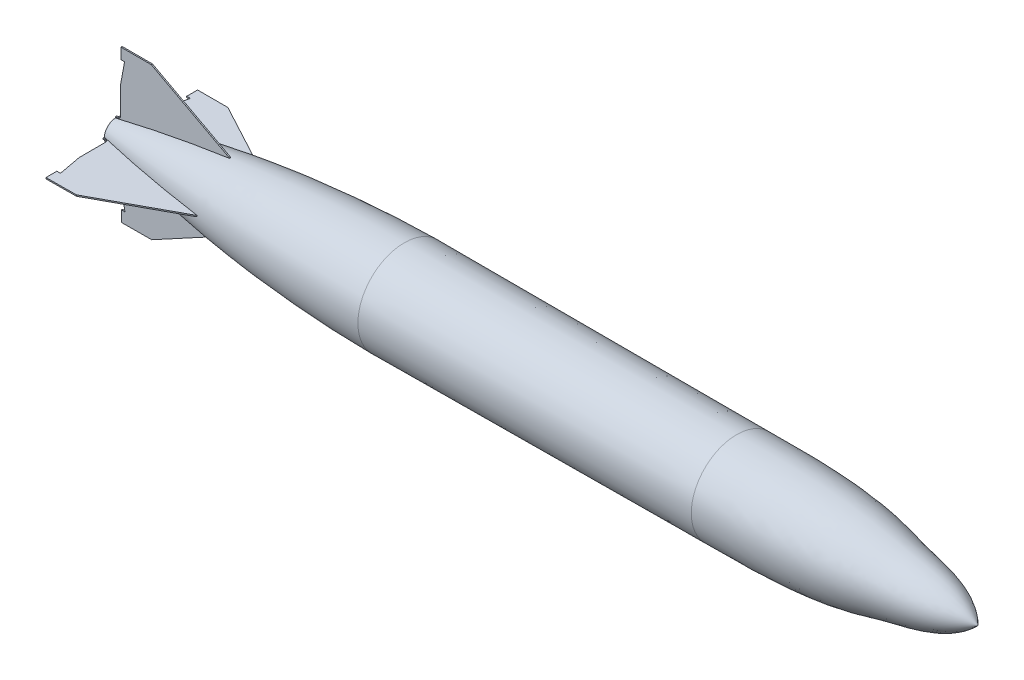
from build123d import *

# Parameters (mm, degrees)
BOSS_EXTRUDE7_START       = 16270.18893537
BOSS_EXTRUDE7_OUTLINE_W   = 44.458339497
BOSS_EXTRUDE7_OUTLINE_H   = 10
BOSS_EXTRUDE7_DEPTH       = 37.555983991
BOSS_EXTRUDE7_START_2     = 16307.744919361
BOSS_EXTRUDE7_2_OUTLINE_W = 4.71364866
BOSS_EXTRUDE7_2_OUTLINE_H = 10
BOSS_EXTRUDE7_2_DEPTH     = 234.687353232
BOSS_EXTRUDE7_START_3     = -5
BOSS_EXTRUDE7_3_DEPTH     = 10
CIRPATTERN13_COUNT        = 4


with BuildPart() as part:
    # Sketch1 → Revolve1 (revolve)
    with BuildSketch(Plane.XY):
        with BuildLine():
            Line((-8927.058200196, 16586.361109833), (-11607.886324288, 16586.361109833))
            add(Edge.make_bspline(
                [(-11607.886324288, 16586.361109833), (-12794.00079163, 16572.101167552), (-13932.987155433, 16298.272117393)],
                knots=[0, 0, 0, 1, 1, 1], degree=2))
            Line((-13932.987155433, 16298.272117393), (-13932.987155433, 16203.629642747))
            Line((-13932.987155433, 16203.629642747), (-6979.778583019, 16226.142638256))
            add(Edge.make_bspline(
                [(-6979.778583019, 16226.142638256), (-7150.744503464, 16405.274346255), (-7653.482511182, 16454.856105961), (-8044.85823717, 16598.87957134), (-8927.058200196, 16586.361109833)],
                knots=[0, 0, 0, 0, 0.479283423, 1, 1, 1, 1], degree=3))
        make_face()
    revolve(axis=Axis((-6979.778583019, 16226.142638256, 0), (-0.9999947584148503, -0.0032377681858395966, 0)))

    # Boss-Extrude7: read off the stored shape, not the designer's step
    # Boss-Extrude7 outline → Boss-Extrude7 (add)
    with BuildSketch(Plane(origin=(0, 0, 0), x_dir=(1, 0, 0), z_dir=(0, 1, 0)).offset(BOSS_EXTRUDE7_START)):
        with Locations((-13910.757985685, 0)):
            Rectangle(BOSS_EXTRUDE7_OUTLINE_W, BOSS_EXTRUDE7_OUTLINE_H)
    boss_extrude7 = extrude(amount=BOSS_EXTRUDE7_DEPTH)

    # Boss-Extrude7 2 outline → Boss-Extrude7 2 (add)
    with BuildSketch(Plane(origin=(0, 0, 0), x_dir=(1, 0, 0), z_dir=(0, 1, 0)).offset(BOSS_EXTRUDE7_START_2)):
        with Locations((-13890.885640266, 0)):
            Rectangle(BOSS_EXTRUDE7_2_OUTLINE_W, BOSS_EXTRUDE7_2_OUTLINE_H)
    boss_extrude7_2 = extrude(amount=BOSS_EXTRUDE7_2_DEPTH)

    # Boss-Extrude7 3 outline → Boss-Extrude7 3 (add)
    with BuildSketch(Plane.XY.offset(BOSS_EXTRUDE7_START_3)):
        with BuildLine():
            ThreePointArc((-13013.286562324, 16475.90038698), (-13016.415282103, 16479.426088343), (-13020.282277859, 16482.121603392))
            Line((-13020.282277859, 16482.121603392), (-13643.830616351, 16815.219302052))
            Line((-13643.830616351, 16815.219302052), (-13888.528815936, 16815.219302052))
            Line((-13888.528815936, 16815.219302052), (-13888.528815936, 16727.537756869))
            Line((-13888.528815936, 16727.537756869), (-13859.092370421, 16727.537756869))
            Line((-13859.092370421, 16727.537756869), (-13893.242464596, 16542.432272593))
            Line((-13893.242464596, 16542.432272593), (-13893.242464596, 16327.744919361))
            ThreePointArc((-13893.242464596, 16327.744919361), (-13899.100328972, 16313.602783737), (-13913.242464596, 16307.744919361))
            Line((-13913.242464596, 16307.744919361), (-13012, 16307.744919361))
            Line((-13012, 16307.744919361), (-13012, 16474.050526318))
            Line((-13012, 16474.050526318), (-13013.286562324, 16475.90038698))
        make_face()
    boss_extrude7_3 = extrude(amount=BOSS_EXTRUDE7_3_DEPTH)

    # CirPattern13: Boss-Extrude7, Boss-Extrude7 2, Boss-Extrude7 3 ×4 about axis
    cirpattern13_axis = Axis((-52.609383054, 16248.571323872, 0), (-0.9999947584148503, -0.0032377681858406513, 0))
    add([boss_extrude7.rotate(cirpattern13_axis, i * 360 / CIRPATTERN13_COUNT) for i in range(1, CIRPATTERN13_COUNT)])
    add([boss_extrude7_2.rotate(cirpattern13_axis, i * 360 / CIRPATTERN13_COUNT) for i in range(1, CIRPATTERN13_COUNT)])
    add([boss_extrude7_3.rotate(cirpattern13_axis, i * 360 / CIRPATTERN13_COUNT) for i in range(1, CIRPATTERN13_COUNT)])


solid = part.part
